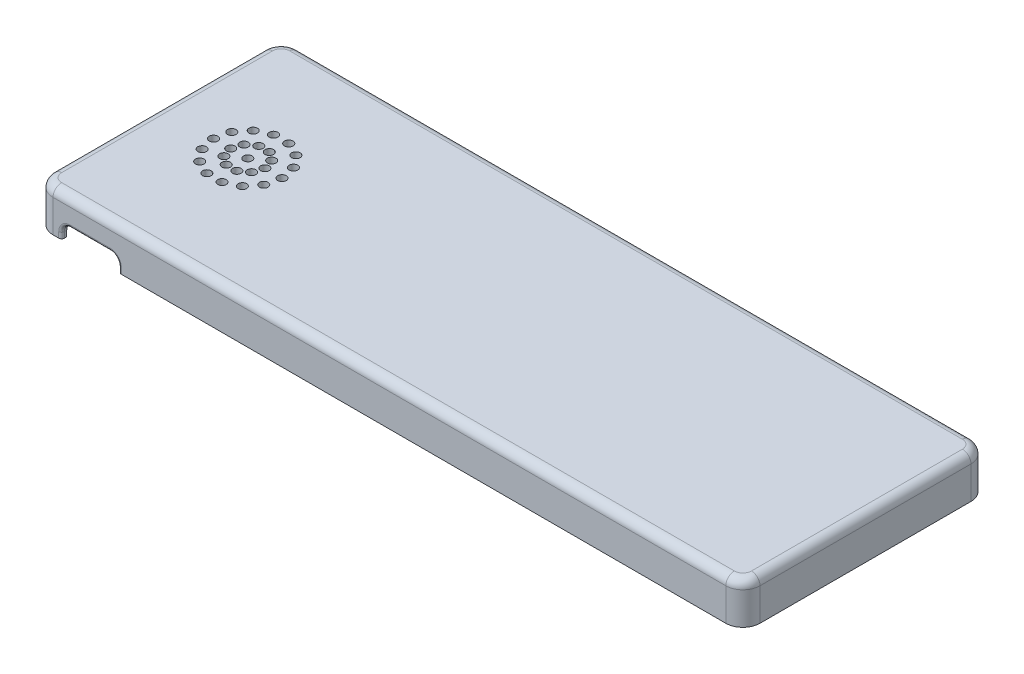
from build123d import *

# Parameters (mm, degrees)
SKETCH_1_W          = 124
SKETCH_1_H          = 43
EXTRUDE_1_DEPTH     = 1.2
FILLET_1_R          = 3
EXTRUDE_2_DEPTH     = 6
SKETCH_3_W          = 5
SKETCH_3_H          = 0.9
CUT_EXTRUDE_1_DEPTH = 3.5
FILLET_2_R          = 3.5
SKETCH_4_W          = 10
SKETCH_4_H          = 0.9
CUT_EXTRUDE_2_DEPTH = 2.5
FILLET_3_R          = 1.5
FILLET_4_R          = 0.5
FILLET_5_R          = 1.5
FILLET_6_R          = 0.8
SKETCH_5_R          = 0.75
CUT_EXTRUDE_4_DEPTH = 1.2


with BuildPart() as part:
    # Эскиз1 → Бобышка-Вытянуть1 (new body)
    with BuildSketch(Plane(origin=(0, 0, 0), x_dir=(1, 0, 0), z_dir=(0, 1, 0))):
        with Locations((0.219687452, 3.060402942)):
            Rectangle(SKETCH_1_W, SKETCH_1_H)
    extrude(amount=EXTRUDE_1_DEPTH)

    # Скругление1
    fillet_1_edges = [part.edges().sort_by_distance(p)[0] for p in [
        (62.219687452, 0.6, 18.439597058),
        (-61.780312548, 0.6, 18.439597058),
        (-61.780312548, 0.6, -24.560402942),
        (62.219687452, 0.6, -24.560402942),
    ]]
    fillet(fillet_1_edges, radius=FILLET_1_R)

    # Эскиз2 → Бобышка-Вытянуть2 (add)
    with BuildSketch(Plane.XZ):
        with BuildLine():
            ThreePointArc((-58.780312548, 18.439597058), (-60.901632891, 17.560917402), (-61.780312548, 15.439597058))
            Line((-61.780312548, 15.439597058), (-61.780312548, -21.560402942))
            ThreePointArc((-61.780312548, -21.560402942), (-60.901632891, -23.681723285), (-58.780312548, -24.560402942))
            Line((-58.780312548, -24.560402942), (59.219687452, -24.560402942))
            ThreePointArc((59.219687452, -24.560402942), (61.341007796, -23.681723285), (62.219687452, -21.560402942))
            Line((62.219687452, -21.560402942), (62.219687452, 15.439597058))
            ThreePointArc((62.219687452, 15.439597058), (61.341007796, 17.560917402), (59.219687452, 18.439597058))
            Line((59.219687452, 18.439597058), (-58.780312548, 18.439597058))
        make_face()
        with BuildLine():
            ThreePointArc((-58.780312548, 17.539597058), (-60.265236788, 16.924521299), (-60.880312548, 15.439597058))
            Line((-60.880312548, 15.439597058), (-60.880312548, -21.560402942))
            ThreePointArc((-60.880312548, -21.560402942), (-60.265236788, -23.045327182), (-58.780312548, -23.660402942))
            Line((-58.780312548, -23.660402942), (59.219687452, -23.660402942))
            ThreePointArc((59.219687452, -23.660402942), (60.704611693, -23.045327182), (61.319687452, -21.560402942))
            Line((61.319687452, -21.560402942), (61.319687452, 15.439597058))
            ThreePointArc((61.319687452, 15.439597058), (60.704611693, 16.924521299), (59.219687452, 17.539597058))
            Line((59.219687452, 17.539597058), (-58.780312548, 17.539597058))
        make_face(mode=Mode.SUBTRACT)
    extrude(amount=EXTRUDE_2_DEPTH)

    # Эскиз3 → Вырез-Вытянуть1 (cut)
    with BuildSketch(Plane.XZ.offset(6)):
        with Locations((-35.480312548, -24.110402942)):
            Rectangle(SKETCH_3_W, SKETCH_3_H)
        with Locations((-40.480312548, -24.110402942)):
            Rectangle(SKETCH_3_W, SKETCH_3_H)
    extrude(amount=-CUT_EXTRUDE_1_DEPTH, mode=Mode.SUBTRACT)

    # Скругление2
    # the kernel refuses this fillet: 3.5 mm, written as the material it takes off along each edge
    with BuildSketch(Plane(origin=(-32.980312548, -2.5, -24.560402942), x_dir=(0, 1, 0), z_dir=(-1, 0, 0))) as fillet_2_piece_1:
        with BuildLine():
            CenterArc((2.343074903, -3.5), FILLET_2_R, 90, 42.024627579)
            Line((0, -0.9), (-0.046861498, -0.848))
            ThreePointArc((-0.046861498, -0.848), (-0.07, -0.45), (-0.07, 0))
            Line((-0.07, 0), (0, 0.07))
            Line((0, 0.07), (2.343074903, 0.07))
            Line((2.343074903, 0.07), (2.343074903, 0))
        make_face()
    extrude(amount=10, mode=Mode.SUBTRACT)
    with BuildSketch(Plane(origin=(-32.980312548, -11.857687257, -24.560402942), x_dir=(1, 0, 0), z_dir=(0, 1, 0))) as fillet_2_piece_2:
        with BuildLine():
            CenterArc((2.343074903, -3.5), FILLET_2_R, 90, 42.024627579)
            Line((0, -0.9), (-0.046861498, -0.848))
            ThreePointArc((-0.046861498, -0.848), (-0.07, -0.45), (-0.07, 0))
            Line((-0.07, 0), (0, 0.07))
            Line((0, 0.07), (2.343074903, 0.07))
            Line((2.343074903, 0.07), (2.343074903, 0))
        make_face()
    extrude(amount=9.357687257, mode=Mode.SUBTRACT)
    with BuildSketch(Plane(origin=(-42.980312548, -11.857687257, -24.560402942), x_dir=(-1, 0, 0), z_dir=(0, 1, 0))) as fillet_2_piece_3:
        with BuildLine():
            CenterArc((2.343074903, 3.5), FILLET_2_R, 227.975372421, 42.024627579)
            Line((0, 0.9), (-0.046861498, 0.848))
            ThreePointArc((-0.046861498, 0.848), (-0.07, 0.45), (-0.07, 0))
            Line((-0.07, 0), (0, -0.07))
            Line((0, -0.07), (2.343074903, -0.07))
            Line((2.343074903, -0.07), (2.343074903, 0))
        make_face()
    extrude(amount=9.357687257, mode=Mode.SUBTRACT)
    with BuildSketch(Plane(origin=(-27.122625291, -2.5, -24.560402942), x_dir=(0, 1, 0), z_dir=(-1, 0, 0))) as fillet_2_piece_4a_section:
        with BuildLine():
            CenterArc((2.343074903, -3.5), FILLET_2_R, 90, 42.024627579)
            Line((0, -0.9), (-0.046861498, -0.848))
            ThreePointArc((-0.046861498, -0.848), (-0.07, -0.45), (-0.07, 0))
            Line((-0.07, 0), (0, 0.07))
            Line((0, 0.07), (2.343074903, 0.07))
            Line((2.343074903, 0.07), (2.343074903, 0))
        make_face()
    fillet_2_piece_4a = extrude(amount=15.857687257, mode=Mode.PRIVATE)
    fillet_2_piece_4a = split(fillet_2_piece_4a, bisect_by=Plane(origin=(-32.980312548, -1.859913318, -24.343955654), z_dir=(1, 0, 0)), keep=Keep.TOP, mode=Mode.PRIVATE)
    with BuildSketch(Plane(origin=(-32.980312548, -11.857687257, -24.560402942), x_dir=(1, 0, 0), z_dir=(0, 1, 0))) as fillet_2_piece_4b_section:
        with BuildLine():
            CenterArc((2.343074903, -3.5), FILLET_2_R, 90, 42.024627579)
            Line((0, -0.9), (-0.046861498, -0.848))
            ThreePointArc((-0.046861498, -0.848), (-0.07, -0.45), (-0.07, 0))
            Line((-0.07, 0), (0, 0.07))
            Line((0, 0.07), (2.343074903, 0.07))
            Line((2.343074903, 0.07), (2.343074903, 0))
        make_face()
    fillet_2_piece_4b = extrude(amount=15.215374514, mode=Mode.PRIVATE)
    fillet_2_piece_4b = split(fillet_2_piece_4b, bisect_by=Plane(origin=(-32.340225866, -2.5, -24.343955654), z_dir=(0, 1, 0)), keep=Keep.TOP, mode=Mode.PRIVATE)
    fillet_2_piece_4 = fillet_2_piece_4a & fillet_2_piece_4b
    add(fillet_2_piece_4, mode=Mode.SUBTRACT)
    with BuildSketch(Plane(origin=(-42.980312548, -11.857687257, -24.560402942), x_dir=(-1, 0, 0), z_dir=(0, 1, 0))) as fillet_2_piece_5a_section:
        with BuildLine():
            CenterArc((2.343074903, 3.5), FILLET_2_R, 227.975372421, 42.024627579)
            Line((0, 0.9), (-0.046861498, 0.848))
            ThreePointArc((-0.046861498, 0.848), (-0.07, 0.45), (-0.07, 0))
            Line((-0.07, 0), (0, -0.07))
            Line((0, -0.07), (2.343074903, -0.07))
            Line((2.343074903, -0.07), (2.343074903, 0))
        make_face()
    fillet_2_piece_5a = extrude(amount=15.215374514, mode=Mode.PRIVATE)
    fillet_2_piece_5a = split(fillet_2_piece_5a, bisect_by=Plane(origin=(-43.62039923, -2.5, -24.343955654), z_dir=(0, 1, 0)), keep=Keep.TOP, mode=Mode.PRIVATE)
    with BuildSketch(Plane(origin=(-32.980312548, -2.5, -24.560402942), x_dir=(0, 1, 0), z_dir=(-1, 0, 0))) as fillet_2_piece_5b_section:
        with BuildLine():
            CenterArc((2.343074903, -3.5), FILLET_2_R, 90, 42.024627579)
            Line((0, -0.9), (-0.046861498, -0.848))
            ThreePointArc((-0.046861498, -0.848), (-0.07, -0.45), (-0.07, 0))
            Line((-0.07, 0), (0, 0.07))
            Line((0, 0.07), (2.343074903, 0.07))
            Line((2.343074903, 0.07), (2.343074903, 0))
        make_face()
    fillet_2_piece_5b = extrude(amount=15.857687257, mode=Mode.PRIVATE)
    fillet_2_piece_5b = split(fillet_2_piece_5b, bisect_by=Plane(origin=(-42.980312548, -1.859913318, -24.343955654), z_dir=(-1, 0, 0)), keep=Keep.TOP, mode=Mode.PRIVATE)
    fillet_2_piece_5 = fillet_2_piece_5a & fillet_2_piece_5b
    add(fillet_2_piece_5, mode=Mode.SUBTRACT)

    # Эскиз4 → Вырез-Вытянуть2 (cut)
    with BuildSketch(Plane.XZ.offset(6)):
        with Locations((-52.280312548, 17.989597058)):
            Rectangle(SKETCH_4_W, SKETCH_4_H)
    extrude(amount=-CUT_EXTRUDE_2_DEPTH, mode=Mode.SUBTRACT)

    # Скругление3
    fillet_3_edges = [part.edges().sort_by_distance(p)[0] for p in [
        (-47.280312548, -3.5, 17.989597058),
        (-57.280312548, -3.5, 17.989597058),
    ]]
    fillet(fillet_3_edges, radius=FILLET_3_R)

    # Скругление4
    fillet_4_edges = [part.edges().sort_by_distance(p)[0] for p in [
        (-57.280312548, -5.5, 18.439597058),
        (-52.280312548, -3.5, 18.439597058),
        (-47.280312548, -5.5, 18.439597058),
        (-56.84097272, -3.939339828, 18.439597058),
        (-47.719652376, -3.939339828, 18.439597058),
    ]]
    fillet(fillet_4_edges, radius=FILLET_4_R)

    # Скругление5
    # the kernel refuses this fillet: 1.5 mm, written as the material it takes off along each edge
    with BuildSketch(Plane(origin=(-58.780312548, 1.2, 15.439597058), x_dir=(0, 0, 1), z_dir=(1, 0, 0))) as fillet_5_piece_1:
        with BuildLine():
            CenterArc((3 - FILLET_5_R, FILLET_5_R), FILLET_5_R, 270, 90)
            Line((3 - FILLET_5_R, 0), (3 - FILLET_5_R, -FILLET_5_R * 0.02))
            Line((3 - FILLET_5_R, -FILLET_5_R * 0.02), (3 + FILLET_5_R * 0.02, -FILLET_5_R * 0.02))
            Line((3 + FILLET_5_R * 0.02, -FILLET_5_R * 0.02), (3 + FILLET_5_R * 0.02, FILLET_5_R))
            Line((3 + FILLET_5_R * 0.02, FILLET_5_R), (3, FILLET_5_R))
        make_face()
    revolve(axis=Axis((-58.780312548, 1.2, 15.439597058), (0, -1, 0)), revolution_arc=90, mode=Mode.SUBTRACT)
    with BuildSketch(Plane(origin=(-61.780312548, 1.2, 15.439597058), x_dir=(0, -1, 0), z_dir=(0, 0, -1))) as fillet_5_piece_2:
        with BuildLine():
            CenterArc((FILLET_5_R, -FILLET_5_R), FILLET_5_R, 90, 90)
            Line((0, -FILLET_5_R), (-FILLET_5_R * 0.02, -FILLET_5_R))
            Line((-FILLET_5_R * 0.02, -FILLET_5_R), (-FILLET_5_R * 0.02, FILLET_5_R * 0.02))
            Line((-FILLET_5_R * 0.02, FILLET_5_R * 0.02), (FILLET_5_R, FILLET_5_R * 0.02))
            Line((FILLET_5_R, FILLET_5_R * 0.02), (FILLET_5_R, 0))
        make_face()
    extrude(amount=37, mode=Mode.SUBTRACT)
    with BuildSketch(Plane(origin=(-58.780312548, 1.2, -21.560402942), x_dir=(0, 0, -1), z_dir=(1, 0, 0))) as fillet_5_piece_3:
        with BuildLine():
            CenterArc((3 - FILLET_5_R, -FILLET_5_R), FILLET_5_R, 0, 90)
            Line((3 - FILLET_5_R, 0), (3 - FILLET_5_R, FILLET_5_R * 0.02))
            Line((3 - FILLET_5_R, FILLET_5_R * 0.02), (3 + FILLET_5_R * 0.02, FILLET_5_R * 0.02))
            Line((3 + FILLET_5_R * 0.02, FILLET_5_R * 0.02), (3 + FILLET_5_R * 0.02, -FILLET_5_R))
            Line((3 + FILLET_5_R * 0.02, -FILLET_5_R), (3, -FILLET_5_R))
        make_face()
    revolve(axis=Axis((-58.780312548, 1.2, -21.560402942), (0, 1, 0)), revolution_arc=90, mode=Mode.SUBTRACT)
    with BuildSketch(Plane(origin=(-58.780312548, 1.2, -24.560402942), x_dir=(0, -1, 0), z_dir=(1, 0, 0)), Plane(origin=(59.219687452, 1.2, 18.439597058), x_dir=(0, -1, 0), z_dir=(-1, 0, 0))) as fillet_5_piece_4:
        with BuildLine():
            CenterArc((FILLET_5_R, -FILLET_5_R), FILLET_5_R, 90, 90)
            Line((0, -FILLET_5_R), (-FILLET_5_R * 0.02, -FILLET_5_R))
            Line((-FILLET_5_R * 0.02, -FILLET_5_R), (-FILLET_5_R * 0.02, FILLET_5_R * 0.02))
            Line((-FILLET_5_R * 0.02, FILLET_5_R * 0.02), (FILLET_5_R, FILLET_5_R * 0.02))
            Line((FILLET_5_R, FILLET_5_R * 0.02), (FILLET_5_R, 0))
        make_face()
    extrude(amount=118, mode=Mode.SUBTRACT)
    with BuildSketch(Plane(origin=(59.219687452, 1.2, -21.560402942), x_dir=(0, 0, -1), z_dir=(-1, 0, 0))) as fillet_5_piece_5:
        with BuildLine():
            CenterArc((3 - FILLET_5_R, FILLET_5_R), FILLET_5_R, 270, 90)
            Line((3, FILLET_5_R), (3 + FILLET_5_R * 0.02, FILLET_5_R))
            Line((3 + FILLET_5_R * 0.02, FILLET_5_R), (3 + FILLET_5_R * 0.02, -FILLET_5_R * 0.02))
            Line((3 + FILLET_5_R * 0.02, -FILLET_5_R * 0.02), (3 - FILLET_5_R, -FILLET_5_R * 0.02))
            Line((3 - FILLET_5_R, -FILLET_5_R * 0.02), (3 - FILLET_5_R, 0))
        make_face()
    revolve(axis=Axis((59.219687452, 1.2, -21.560402942), (0, -1, 0)), revolution_arc=90, mode=Mode.SUBTRACT)
    with BuildSketch(Plane(origin=(62.219687452, 1.2, -21.560402942), x_dir=(-1, 0, 0), z_dir=(0, 0, 1))) as fillet_5_piece_6:
        with BuildLine():
            CenterArc((FILLET_5_R, FILLET_5_R), FILLET_5_R, 180, 90)
            Line((0, FILLET_5_R), (-FILLET_5_R * 0.02, FILLET_5_R))
            Line((-FILLET_5_R * 0.02, FILLET_5_R), (-FILLET_5_R * 0.02, -FILLET_5_R * 0.02))
            Line((-FILLET_5_R * 0.02, -FILLET_5_R * 0.02), (FILLET_5_R, -FILLET_5_R * 0.02))
            Line((FILLET_5_R, -FILLET_5_R * 0.02), (FILLET_5_R, 0))
        make_face()
    extrude(amount=37, mode=Mode.SUBTRACT)
    with BuildSketch(Plane(origin=(59.219687452, 1.2, 15.439597058), x_dir=(1, 0, 0), z_dir=(0, 0, -1))) as fillet_5_piece_7:
        with BuildLine():
            CenterArc((3 - FILLET_5_R, FILLET_5_R), FILLET_5_R, 270, 90)
            Line((3 - FILLET_5_R, 0), (3 - FILLET_5_R, -FILLET_5_R * 0.02))
            Line((3 - FILLET_5_R, -FILLET_5_R * 0.02), (3 + FILLET_5_R * 0.02, -FILLET_5_R * 0.02))
            Line((3 + FILLET_5_R * 0.02, -FILLET_5_R * 0.02), (3 + FILLET_5_R * 0.02, FILLET_5_R))
            Line((3 + FILLET_5_R * 0.02, FILLET_5_R), (3, FILLET_5_R))
        make_face()
    revolve(axis=Axis((59.219687452, 1.2, 15.439597058), (0, -1, 0)), revolution_arc=90, mode=Mode.SUBTRACT)

    # Скругление6
    fillet_6_edges = [part.edges().sort_by_distance(p)[0] for p in [
        (-60.265236788, 0, 16.924521299),
        (-60.880312548, 0, -3.060402942),
        (-60.265236788, 0, -23.045327182),
        (0.219687452, 0, -23.660402942),
        (60.704611693, 0, -23.045327182),
        (61.319687452, 0, -3.060402942),
        (60.704611693, 0, 16.924521299),
        (0.219687452, 0, 17.539597058),
    ]]
    fillet(fillet_6_edges, radius=FILLET_6_R)

    # Эскиз5 → Вырез-Вытянуть4 (cut)
    with BuildSketch(Plane(origin=(0, 1.2, 0), x_dir=(1, 0, 0), z_dir=(0, 1, 0))):
        with BuildLine():
            ThreePointArc((-51.372963065, 3.060402942), (-52.122963065, 3.810402942), (-52.872963065, 3.060402942))
            Line((-52.872963065, 3.060402942), (-51.372963065, 3.060402942))
        make_face()
        with BuildLine():
            Line((-51.372963065, 3.060402942), (-52.872963065, 3.060402942))
            ThreePointArc((-52.872963065, 3.060402942), (-52.122963065, 2.310402942), (-51.372963065, 3.060402942))
        make_face()
        with BuildLine():
            ThreePointArc((-48.372963065, 3.060402942), (-49.122963065, 3.810402942), (-49.872963065, 3.060402942))
            Line((-49.872963065, 3.060402942), (-48.372963065, 3.060402942))
        make_face()
        with BuildLine():
            Line((-48.372963065, 3.060402942), (-49.872963065, 3.060402942))
            ThreePointArc((-49.872963065, 3.060402942), (-49.122963065, 2.310402942), (-48.372963065, 3.060402942))
        make_face()
        with BuildLine():
            ThreePointArc((-45.372963065, 3.060402942), (-46.122963065, 3.810402942), (-46.872963065, 3.060402942))
            Line((-46.872963065, 3.060402942), (-45.372963065, 3.060402942))
        make_face()
        with BuildLine():
            Line((-45.372963065, 3.060402942), (-46.872963065, 3.060402942))
            ThreePointArc((-46.872963065, 3.060402942), (-46.122963065, 2.310402942), (-45.372963065, 3.060402942))
        make_face()
        with BuildLine():
            ThreePointArc((-42.372963065, 3.060402942), (-43.122963065, 3.810402942), (-43.872963065, 3.060402942))
            Line((-43.872963065, 3.060402942), (-42.372963065, 3.060402942))
        make_face()
        with BuildLine():
            Line((-42.372963065, 3.060402942), (-43.872963065, 3.060402942))
            ThreePointArc((-43.872963065, 3.060402942), (-43.122963065, 2.310402942), (-42.372963065, 3.060402942))
        make_face()
        with BuildLine():
            ThreePointArc((-39.372963065, 3.060402942), (-40.122963065, 3.810402942), (-40.872963065, 3.060402942))
            Line((-40.872963065, 3.060402942), (-39.372963065, 3.060402942))
        make_face()
        with BuildLine():
            Line((-39.372963065, 3.060402942), (-40.872963065, 3.060402942))
            ThreePointArc((-40.872963065, 3.060402942), (-40.122963065, 2.310402942), (-39.372963065, 3.060402942))
        make_face()
        with Locations(Location((-43.695912081, 4.823758699, 0), (0, 0, 270))):
            Circle(SKETCH_5_R)
        with Locations(Location((-45.195912081, 5.913572491, 0), (0, 0, 270))):
            Circle(SKETCH_5_R)
        with Locations(Location((-47.050014048, 5.913572491, 0), (0, 0, 270))):
            Circle(SKETCH_5_R)
        with Locations(Location((-48.550014048, 4.823758699, 0), (0, 0, 270))):
            Circle(SKETCH_5_R)
        with Locations(Location((-51.528776272, 5.663705376, 0), (0, 0, 270))):
            Circle(SKETCH_5_R)
        with Locations(Location((-49.863901876, 7.751391836, 0), (0, 0, 270))):
            Circle(SKETCH_5_R)
        with Locations(Location((-47.458088668, 8.909970415, 0), (0, 0, 270))):
            Circle(SKETCH_5_R)
        with Locations(Location((-44.787837461, 8.909970415, 0), (0, 0, 270))):
            Circle(SKETCH_5_R)
        with Locations(Location((-42.382024253, 7.751391836, 0), (0, 0, 270))):
            Circle(SKETCH_5_R)
        with Locations(Location((-40.717149857, 5.663705376, 0), (0, 0, 270))):
            Circle(SKETCH_5_R)
        with Locations(Location((-40.717149857, 0.457100507, 0), (0, 0, 270))):
            Circle(SKETCH_5_R)
        with Locations(Location((-42.382024253, -1.630585953, 0), (0, 0, 270))):
            Circle(SKETCH_5_R)
        with Locations(Location((-44.787837461, -2.789164531, 0), (0, 0, 270))):
            Circle(SKETCH_5_R)
        with Locations(Location((-47.458088668, -2.789164531, 0), (0, 0, 270))):
            Circle(SKETCH_5_R)
        with Locations(Location((-51.528776272, 0.457100507, 0), (0, 0, 270))):
            Circle(SKETCH_5_R)
        with Locations(Location((-48.550014048, 1.297047185, 0), (0, 0, 270))):
            Circle(SKETCH_5_R)
        with Locations(Location((-43.695912081, 1.297047185, 0), (0, 0, 270))):
            Circle(SKETCH_5_R)
        with Locations(Location((-49.863901876, -1.630585953, 0), (0, 0, 270))):
            Circle(SKETCH_5_R)
        with Locations(Location((-47.050014048, 0.207233393, 0), (0, 0, 270))):
            Circle(SKETCH_5_R)
        with Locations(Location((-45.195912081, 0.207233393, 0), (0, 0, 270))):
            Circle(SKETCH_5_R)
    extrude(amount=-CUT_EXTRUDE_4_DEPTH, mode=Mode.SUBTRACT)


solid = part.part
